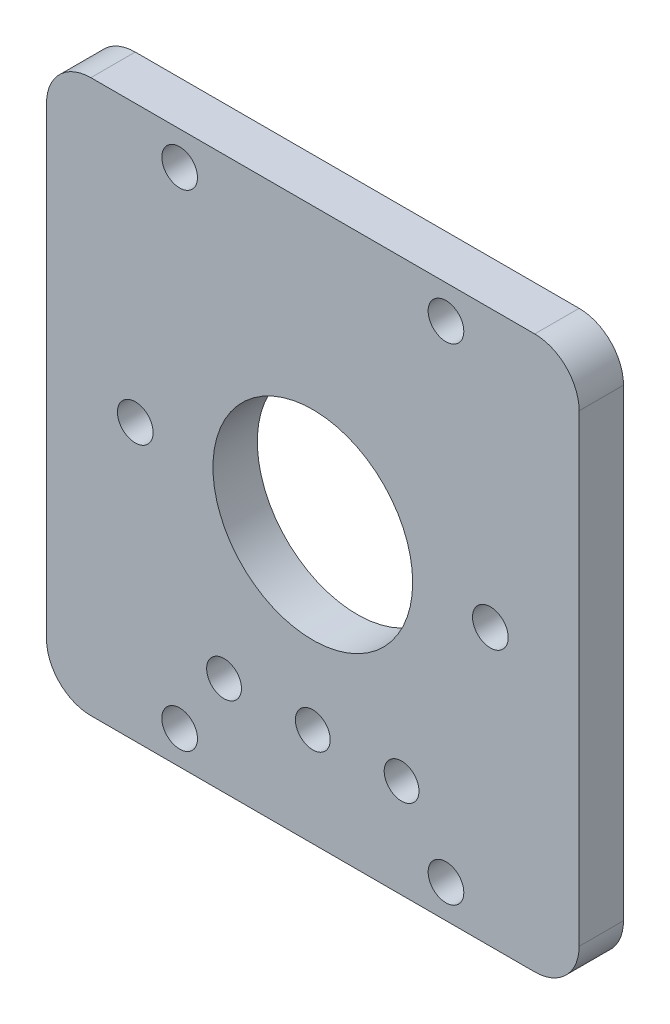
from build123d import *

# Parameters (mm, degrees)
SKETCH5_W           = 76.2
SKETCH5_H           = 79.04988
SKETCH5_R           = 2.5527
SKETCH5_R_2         = 2.4892
SKETCH5_R_3         = 14.2875
BOSS_EXTRUDE1_DEPTH = 6.35
FILLET2_R           = 6.35


with BuildPart() as part:
    # Sketch5 → Boss-Extrude1 (new body)
    with BuildSketch(Plane.XY):
        Rectangle(SKETCH5_W, SKETCH5_H)
        with Locations((-19.05, -34.76244)):
            Circle(SKETCH5_R, mode=Mode.SUBTRACT)
        with Locations((-12.7, -25.4)):
            Circle(SKETCH5_R_2, mode=Mode.SUBTRACT)
        with Locations((0, -25.4)):
            Circle(SKETCH5_R_2, mode=Mode.SUBTRACT)
        with Locations((12.7, -25.4)):
            Circle(SKETCH5_R_2, mode=Mode.SUBTRACT)
        with Locations((19.05, -34.76244)):
            Circle(SKETCH5_R, mode=Mode.SUBTRACT)
        with Locations((-25.4, 0)):
            Circle(SKETCH5_R, mode=Mode.SUBTRACT)
        with Locations((-19.05, 34.76244)):
            Circle(SKETCH5_R, mode=Mode.SUBTRACT)
        Circle(SKETCH5_R_3, mode=Mode.SUBTRACT)
        with Locations((25.4, 0)):
            Circle(SKETCH5_R, mode=Mode.SUBTRACT)
        with Locations((19.05, 34.76244)):
            Circle(SKETCH5_R, mode=Mode.SUBTRACT)
    extrude(amount=BOSS_EXTRUDE1_DEPTH)

    # Fillet2
    fillet2_edges = [part.edges().sort_by_distance(p)[0] for p in [
        (-38.1, -39.52494, 3.175),
        (38.1, -39.52494, 3.175),
        (38.1, 39.52494, 3.175),
        (-38.1, 39.52494, 3.175),
    ]]
    fillet(fillet2_edges, radius=FILLET2_R)


solid = part.part
